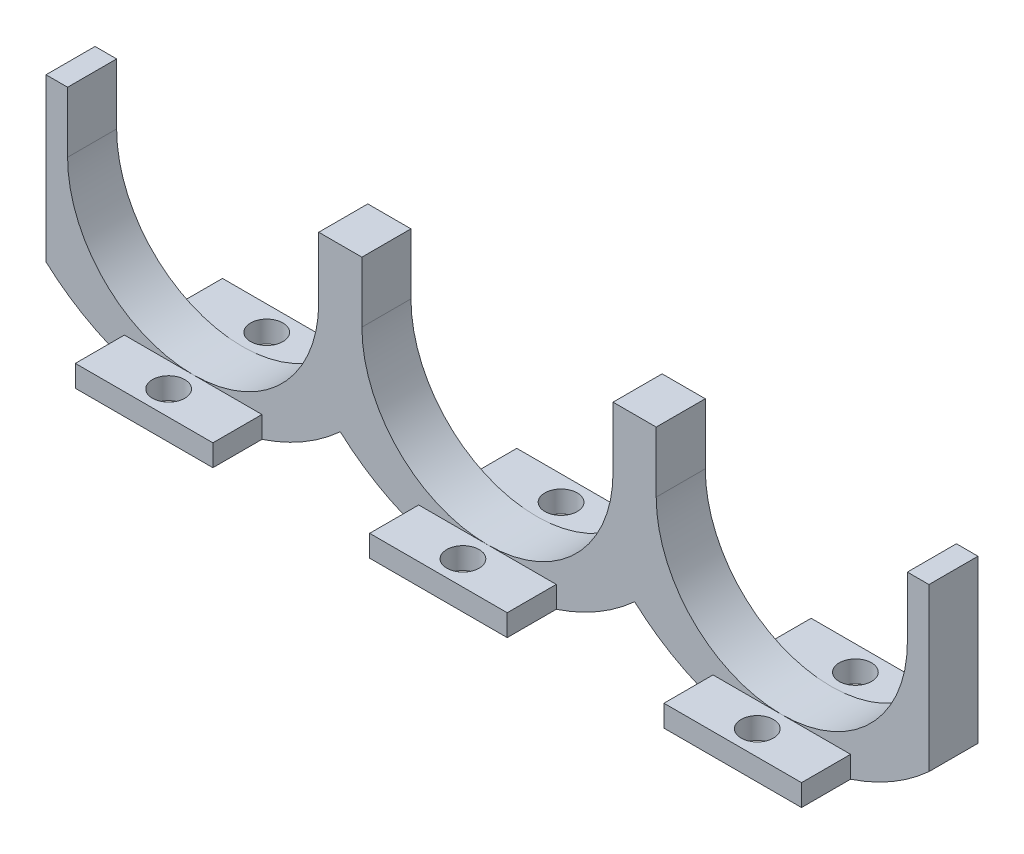
from build123d import *

# Parameters (mm, degrees)
SKETCH1_W               = 76.2
SKETCH1_H               = 228.6
BOSS_EXTRUDE1_DEPTH     = 38.1
SKETCH2_R               = 32.512
CUT_EXTRUDE2_DEPTH      = 244.959033446
SKETCH3_W               = 5.588
SKETCH3_H               = 15.705533419
BOSS_EXTRUDE2_DEPTH     = 228.6
SKETCH4_W               = 8.89
SKETCH4_H               = 5.08
CUT_EXTRUDE3_DEPTH      = 247.899646469
CRVPATTERN1_START       = -228.6
CRVPATTERN1_OUTLINE_W   = 5.588
CRVPATTERN1_OUTLINE_H   = 5.312766709
CRVPATTERN1_DEPTH       = 228.6
CRVPATTERN1_START_2     = -165.1
CRVPATTERN1_2_OUTLINE_W = 5.588
CRVPATTERN1_2_OUTLINE_H = 5.08
CRVPATTERN1_2_DEPTH     = 101.6
CRVPATTERN1_3_OUTLINE_W = 5.588
CRVPATTERN1_3_OUTLINE_H = 5.08
CRVPATTERN1_3_DEPTH     = 54.61
CRVPATTERN1_START_3     = -54.61
CRVPATTERN1_4_OUTLINE_W = 5.588
CRVPATTERN1_4_OUTLINE_H = 5.08
CRVPATTERN1_4_DEPTH     = 54.61
CRVPATTERN1_5_OUTLINE_W = 5.588
CRVPATTERN1_5_OUTLINE_H = 5.312766709
CRVPATTERN1_5_DEPTH     = 228.6
CRVPATTERN1_6_OUTLINE_W = 5.588
CRVPATTERN1_6_OUTLINE_H = 5.08
CRVPATTERN1_6_DEPTH     = 101.6
CRVPATTERN1_7_OUTLINE_W = 5.588
CRVPATTERN1_7_OUTLINE_H = 5.08
CRVPATTERN1_7_DEPTH     = 54.61
CRVPATTERN1_8_OUTLINE_W = 5.588
CRVPATTERN1_8_OUTLINE_H = 5.08
CRVPATTERN1_8_DEPTH     = 54.61
SKETCH6_W               = 215.9
SKETCH6_H               = 53.805533419
CUT_EXTRUDE4_DEPTH      = 328.736106382
CUT_EXTRUDE5_DEPTH      = 236.189892271
BOSS_EXTRUDE4_START     = -5.588
SKETCH8_W               = 35.618239262
SKETCH8_H               = 38.1
BOSS_EXTRUDE4_DEPTH     = 5.588
SKETCH9_R               = 4.191
CUT_EXTRUDE6_DEPTH      = 236.006490398


# Read off the part's stored shape, not the designer's step: CrvPattern1
with BuildPart() as part:
    # Sketch1 → Boss-Extrude1 (new body)
    with BuildSketch(Plane(origin=(0, 0, 0), x_dir=(1, 0, 0), z_dir=(0, 1, 0))):
        with Locations((38.1, 114.3)):
            Rectangle(SKETCH1_W, SKETCH1_H)
    extrude(amount=BOSS_EXTRUDE1_DEPTH)

    # Sketch2 → Cut-Extrude2 (cut, through all)
    with BuildSketch(Plane.XY):
        with Locations((38.1, 38.1)):
            Circle(SKETCH2_R)
    extrude(amount=-CUT_EXTRUDE2_DEPTH, mode=Mode.SUBTRACT)

    # Sketch3 → Boss-Extrude2 (add)
    with BuildSketch(Plane.XY):
        with Locations((2.794, 45.95276671)):
            Rectangle(SKETCH3_W, SKETCH3_H)
        with Locations((73.406, 45.95276671)):
            Rectangle(SKETCH3_W, SKETCH3_H)
    extrude(amount=-BOSS_EXTRUDE2_DEPTH)

    # Sketch4 → Cut-Extrude3 (cut, through all)
    with BuildSketch(Plane(origin=(76.2, 0, 0), x_dir=(0, 0, -1), z_dir=(1, 0, 0))):
        with Locations((59.055, 45.95276671)):
            Rectangle(SKETCH4_W, SKETCH4_H)
        with Locations((169.545, 45.95276671)):
            Rectangle(SKETCH4_W, SKETCH4_H)
    extrude(amount=-CUT_EXTRUDE3_DEPTH, mode=Mode.SUBTRACT)


with BuildPart() as body_2:
    # CrvPattern1 outline → CrvPattern1 (new body)
    with BuildSketch(Plane.XY.offset(CRVPATTERN1_START)):
        with BuildLine():
            Line((152.4, 43.41276671), (152.4, 0))
            Line((152.4, 0), (228.6, 0))
            Line((228.6, 0), (228.6, 43.41276671))
            Line((228.6, 43.41276671), (223.012, 43.41276671))
            Line((223.012, 43.41276671), (223.012, 38.1))
            ThreePointArc((223.012, 38.1), (190.5, 5.588), (157.988, 38.1))
            Line((157.988, 38.1), (157.988, 43.41276671))
            Line((157.988, 43.41276671), (152.4, 43.41276671))
        make_face()
        with Locations((155.194, 51.149150065)):
            Rectangle(CRVPATTERN1_OUTLINE_W, CRVPATTERN1_OUTLINE_H)
        with Locations((225.806, 51.149150065)):
            Rectangle(CRVPATTERN1_OUTLINE_W, CRVPATTERN1_OUTLINE_H)
    extrude(amount=CRVPATTERN1_DEPTH)

    # CrvPattern1 2 outline → CrvPattern1 2 (add)
    with BuildSketch(Plane.XY.offset(CRVPATTERN1_START_2)):
        with Locations((155.194, 45.95276671)):
            Rectangle(CRVPATTERN1_2_OUTLINE_W, CRVPATTERN1_2_OUTLINE_H)
        with Locations((225.806, 45.95276671)):
            Rectangle(CRVPATTERN1_2_OUTLINE_W, CRVPATTERN1_2_OUTLINE_H)
    extrude(amount=CRVPATTERN1_2_DEPTH)

    # CrvPattern1 3 outline → CrvPattern1 3 (add)
    with BuildSketch(Plane.XY.offset(CRVPATTERN1_START)):
        with Locations((155.194, 45.95276671)):
            Rectangle(CRVPATTERN1_3_OUTLINE_W, CRVPATTERN1_3_OUTLINE_H)
        with Locations((225.806, 45.95276671)):
            Rectangle(CRVPATTERN1_3_OUTLINE_W, CRVPATTERN1_3_OUTLINE_H)
    extrude(amount=CRVPATTERN1_3_DEPTH)

    # CrvPattern1 4 outline → CrvPattern1 4 (add)
    with BuildSketch(Plane.XY.offset(CRVPATTERN1_START_3)):
        with Locations((155.194, 45.95276671)):
            Rectangle(CRVPATTERN1_4_OUTLINE_W, CRVPATTERN1_4_OUTLINE_H)
        with Locations((225.806, 45.95276671)):
            Rectangle(CRVPATTERN1_4_OUTLINE_W, CRVPATTERN1_4_OUTLINE_H)
    extrude(amount=CRVPATTERN1_4_DEPTH)


with BuildPart() as body_3:
    # CrvPattern1 5 outline → CrvPattern1 5 (new body)
    with BuildSketch(Plane.XY.offset(CRVPATTERN1_START)):
        with BuildLine():
            Line((76.2, 43.41276671), (76.2, 0))
            Line((76.2, 0), (152.4, 0))
            Line((152.4, 0), (152.4, 43.41276671))
            Line((152.4, 43.41276671), (146.812, 43.41276671))
            Line((146.812, 43.41276671), (146.812, 38.1))
            ThreePointArc((146.812, 38.1), (114.3, 5.588), (81.788, 38.1))
            Line((81.788, 38.1), (81.788, 43.41276671))
            Line((81.788, 43.41276671), (76.2, 43.41276671))
        make_face()
        with Locations((78.994, 51.149150065)):
            Rectangle(CRVPATTERN1_5_OUTLINE_W, CRVPATTERN1_5_OUTLINE_H)
        with Locations((149.606, 51.149150065)):
            Rectangle(CRVPATTERN1_5_OUTLINE_W, CRVPATTERN1_5_OUTLINE_H)
    extrude(amount=CRVPATTERN1_5_DEPTH)

    # CrvPattern1 6 outline → CrvPattern1 6 (add)
    with BuildSketch(Plane.XY.offset(CRVPATTERN1_START_2)):
        with Locations((78.994, 45.95276671)):
            Rectangle(CRVPATTERN1_6_OUTLINE_W, CRVPATTERN1_6_OUTLINE_H)
        with Locations((149.606, 45.95276671)):
            Rectangle(CRVPATTERN1_6_OUTLINE_W, CRVPATTERN1_6_OUTLINE_H)
    extrude(amount=CRVPATTERN1_6_DEPTH)

    # CrvPattern1 7 outline → CrvPattern1 7 (add)
    with BuildSketch(Plane.XY.offset(CRVPATTERN1_START)):
        with Locations((78.994, 45.95276671)):
            Rectangle(CRVPATTERN1_7_OUTLINE_W, CRVPATTERN1_7_OUTLINE_H)
        with Locations((149.606, 45.95276671)):
            Rectangle(CRVPATTERN1_7_OUTLINE_W, CRVPATTERN1_7_OUTLINE_H)
    extrude(amount=CRVPATTERN1_7_DEPTH)

    # CrvPattern1 8 outline → CrvPattern1 8 (add)
    with BuildSketch(Plane.XY.offset(CRVPATTERN1_START_3)):
        with Locations((78.994, 45.95276671)):
            Rectangle(CRVPATTERN1_8_OUTLINE_W, CRVPATTERN1_8_OUTLINE_H)
        with Locations((149.606, 45.95276671)):
            Rectangle(CRVPATTERN1_8_OUTLINE_W, CRVPATTERN1_8_OUTLINE_H)
    extrude(amount=CRVPATTERN1_8_DEPTH)


with BuildPart() as cut_extrude4_tool:
    # Sketch6 → Cut-Extrude4 (new, through all)
    with BuildSketch(Plane.ZY):
        with Locations((-120.65, 26.90276671)):
            Rectangle(SKETCH6_W, SKETCH6_H)
    extrude(amount=-CUT_EXTRUDE4_DEPTH)


with BuildPart() as part_1:
    add(part.part)

    # Cut-Extrude4: cut by cut_extrude4_tool
    add(cut_extrude4_tool.part, mode=Mode.SUBTRACT)


with BuildPart() as body_2_1:
    add(body_2.part)

    # Cut-Extrude4: cut by cut_extrude4_tool
    add(cut_extrude4_tool.part, mode=Mode.SUBTRACT)


with BuildPart() as body_3_1:
    add(body_3.part)

    # Cut-Extrude4: cut by cut_extrude4_tool
    add(cut_extrude4_tool.part, mode=Mode.SUBTRACT)


with BuildPart() as cut_extrude5_tool:
    # Sketch7 → Cut-Extrude5 (new, through all)
    with BuildSketch(Plane.XY):
        with BuildLine():
            Line((0, 0), (20.290880369, 0))
            ThreePointArc((20.290880369, 0), (9.524832285, 4.860053969), (0, 11.846146286))
            Line((0, 11.846146286), (0, 0))
        make_face()
        with BuildLine():
            Line((228.6, 0), (228.6, 11.846146286))
            ThreePointArc((228.6, 11.846146286), (219.075167715, 4.860053969), (208.309119631, 0))
            Line((208.309119631, 0), (228.6, 0))
        make_face()
        with BuildLine():
            Line((55.909119631, 0), (96.490880369, 0))
            ThreePointArc((96.490880369, 0), (85.724832285, 4.860053969), (76.2, 11.846146286))
            ThreePointArc((76.2, 11.846146286), (66.675167715, 4.860053969), (55.909119631, 0))
        make_face()
        with BuildLine():
            Line((132.109119631, 0), (172.690880369, 0))
            ThreePointArc((172.690880369, 0), (161.924832285, 4.860053969), (152.4, 11.846146286))
            ThreePointArc((152.4, 11.846146286), (142.875167715, 4.860053969), (132.109119631, 0))
        make_face()
    extrude(amount=-CUT_EXTRUDE5_DEPTH)


with BuildPart() as part_2:
    add(part_1.part)

    # Cut-Extrude5: cut by cut_extrude5_tool
    add(cut_extrude5_tool.part, mode=Mode.SUBTRACT)



with BuildPart() as body_2_2:
    add(body_2_1.part)

    # Cut-Extrude5: cut by cut_extrude5_tool
    add(cut_extrude5_tool.part, mode=Mode.SUBTRACT)


with BuildPart() as body_3_2:
    add(body_3_1.part)

    # Cut-Extrude5: cut by cut_extrude5_tool
    add(cut_extrude5_tool.part, mode=Mode.SUBTRACT)


with BuildPart() as part_3:
    add(part_2.part)

    add(body_2_2.part)  # Boss-Extrude4 merges body 2

    add(body_3_2.part)  # Boss-Extrude4 merges body 3
    # Sketch8 → Boss-Extrude4 (add)
    with BuildSketch(Plane(origin=(0, 0, 0), x_dir=(-1, 0, 0), z_dir=(0, -1, 0)).offset(BOSS_EXTRUDE4_START)):
        with Locations((-38.1, 6.35)):
            Rectangle(SKETCH8_W, SKETCH8_H)
        with Locations((-114.3, 6.35)):
            Rectangle(SKETCH8_W, SKETCH8_H)
        with Locations((-190.5, 6.35)):
            Rectangle(SKETCH8_W, SKETCH8_H)
    extrude(amount=BOSS_EXTRUDE4_DEPTH)

    # Sketch9 → Cut-Extrude6 (cut, through all)
    with BuildSketch(Plane(origin=(0, 5.588, 0), x_dir=(1, 0, 0), z_dir=(0, 1, 0))):
        with Locations(Location((38.1, 19.05, 0), (0, 0, 270))):
            Circle(SKETCH9_R)
        with Locations(Location((114.3, 19.05, 0), (0, 0, 270))):
            Circle(SKETCH9_R)
        with Locations(Location((190.5, 19.05, 0), (0, 0, 270))):
            Circle(SKETCH9_R)
        with Locations(Location((114.3, -6.35, 0), (0, 0, 270))):
            Circle(SKETCH9_R)
        with Locations(Location((190.5, -6.35, 0), (0, 0, 270))):
            Circle(SKETCH9_R)
        with Locations(Location((38.1, -6.35, 0), (0, 0, 270))):
            Circle(SKETCH9_R)
    extrude(amount=-CUT_EXTRUDE6_DEPTH, mode=Mode.SUBTRACT)


solid = part_3.part
